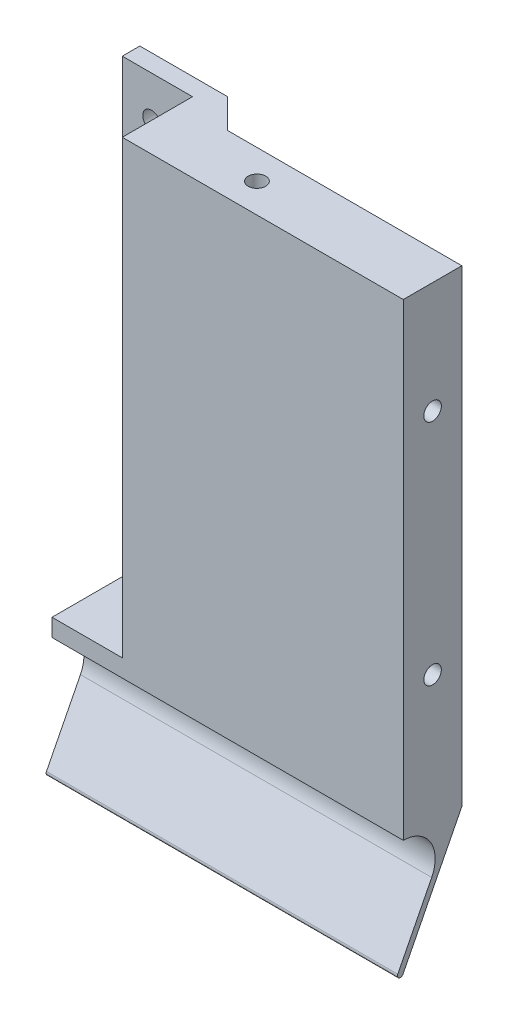
from build123d import *

# Parameters (mm, degrees)
BOSS_EXTRUDE1_DEPTH = 80
SKETCH2_3_W         = 12
SKETCH2_3_H         = 12
BOSS_EXTRUDE2_DEPTH = 3
SKETCH4_R           = 1.5
CUT_EXTRUDE1_DEPTH  = 96.322713731
SKETCH5_R           = 1.5
CUT_EXTRUDE2_DEPTH  = 126.307213604
CUT_EXTRUDE3_DEPTH  = 8
SKETCH7_R           = 1.5
CUT_EXTRUDE5_DEPTH  = 20
BOSS_EXTRUDE3_START = -60
BOSS_EXTRUDE3_DEPTH = 60
CHAMFER1_SIZE       = 5


with BuildPart() as part:
    # Sketch2 → Boss-Extrude1 (new body)
    with BuildSketch(Plane(origin=(0, 0, 0), x_dir=(1, 0, 0), z_dir=(0, 1, 0))):
        Polygon((-80.696905807, 19.555555556), (-95.696905807, 19.555555556), (-95.696905807, 16.555555556), (-83.696905807, 16.555555556), (-83.696905807, 4.555555556), (-35.696905807, 4.555555556), (-35.696905807, 14.555555556), (-80.696905807, 14.555555556), align=None)
    extrude(amount=BOSS_EXTRUDE1_DEPTH)

    # Sketch2<3> → Boss-Extrude2 (add)
    with BuildSketch(Plane(origin=(0, 0, 0), x_dir=(1, 0, 0), z_dir=(0, 1, 0))):
        with Locations((-89.696905807, 10.555555556)):
            Rectangle(SKETCH2_3_W, SKETCH2_3_H)
    extrude(amount=BOSS_EXTRUDE2_DEPTH)

    # Sketch4 → Cut-Extrude1 (cut, through all)
    with BuildSketch(Plane.ZY.offset(83.696905807)):
        with Locations((-9.555555556, 22)):
            Circle(SKETCH4_R)
        with Locations((-9.555555556, 61)):
            Circle(SKETCH4_R)
    extrude(amount=-CUT_EXTRUDE1_DEPTH, mode=Mode.SUBTRACT)

    # Sketch5 → Cut-Extrude2 (cut, through all)
    with BuildSketch(Plane.XY.offset(-16.555555556)):
        with Locations((-90.696905807, 10)):
            Circle(SKETCH5_R)
        with Locations((-90.696905807, 73)):
            Circle(SKETCH5_R)
    extrude(amount=-CUT_EXTRUDE2_DEPTH, mode=Mode.SUBTRACT)

    # Sketch6 → Cut-Extrude3 (cut)
    with BuildSketch(Plane(origin=(0, 0, -14.555555556), x_dir=(-1, 0, 0), z_dir=(0, 0, -1))):
        with BuildLine():
            Line((67.723185249, 52), (70.89861173, 57.5))
            Line((70.89861173, 57.5), (67.723185249, 63))
            ThreePointArc((67.723185249, 63), (58.196905807, 68.5), (48.670626366, 63))
            Line((48.670626366, 63), (45.495199885, 57.5))
            Line((45.495199885, 57.5), (48.670626366, 52))
            ThreePointArc((48.670626366, 52), (58.196905807, 46.5), (67.723185249, 52))
        make_face()
    extrude(amount=-CUT_EXTRUDE3_DEPTH, mode=Mode.SUBTRACT)

    # Sketch7 → Cut-Extrude5 (cut)
    with BuildSketch(Plane(origin=(0, 80, 0), x_dir=(1, 0, 0), z_dir=(0, 1, 0))):
        with Locations(Location((-65.696905807, 9.555555556, 0), (0, 0, 270))):
            Circle(SKETCH7_R)
    extrude(amount=-CUT_EXTRUDE5_DEPTH, mode=Mode.SUBTRACT)

    # Sketch8 → Boss-Extrude3 (add)
    with BuildSketch(Plane(origin=(-35.696905807, 0, 0), x_dir=(0, 0, -1), z_dir=(1, 0, 0)).offset(BOSS_EXTRUDE3_START)):
        with BuildLine():
            Line((14.555555556, 0), (4.501282487, -19.780828807))
            ThreePointArc((4.501282487, -19.780828807), (3.828999817, -20), (3.609828624, -19.32771733))
            Line((3.609828624, -19.32771733), (9.410961448, -7.914538626))
            ThreePointArc((9.410961448, -7.914538626), (9.198154182, -2.598476584), (4.555555556, 0))
            Line((4.555555556, 0), (14.555555556, 0))
        make_face()
    extrude(amount=BOSS_EXTRUDE3_DEPTH)

    # Chamfer1
    chamfer1_edges = [part.edges().sort_by_distance(p)[0] for p in [
        (-80.696905807, 40, -14.555555556),
    ]]
    chamfer(chamfer1_edges, length=CHAMFER1_SIZE - 0.0001)  # a hair under: the kernel refuses the full size


solid = part.part
